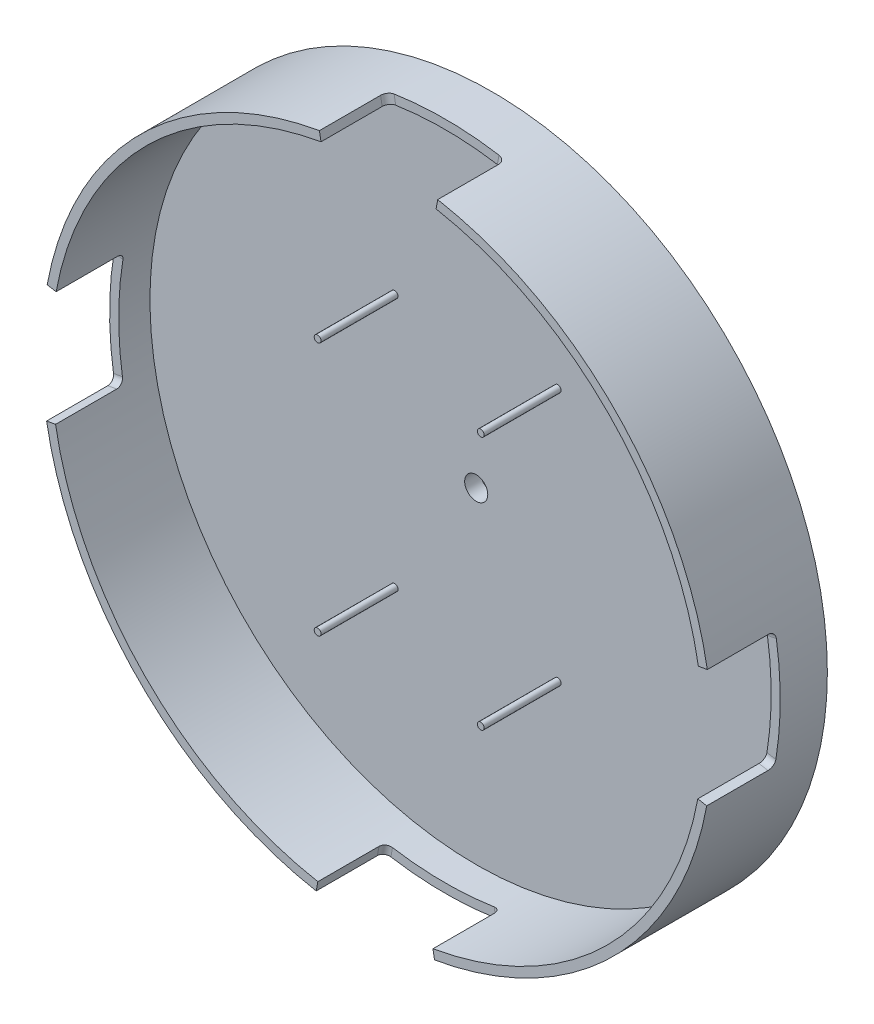
from build123d import *

# Parameters (mm, degrees)
SKETCH1_R           = 74
SKETCH1_R_2         = 2.55
BOSS_EXTRUDE1_DEPTH = 3.5
SKETCH2_R           = 32.5
SKETCH2_R_2         = 16
CUT_EXTRUDE4_DEPTH  = 1
FILLET1_R           = 1.5
FILLET2_R           = 1.5
SKETCH3_R           = 74
SKETCH3_R_2         = 72
BOSS_EXTRUDE2_DEPTH = 25.4
CUT_EXTRUDE5_START  = -15
CUT_EXTRUDE5_DEPTH  = 15
CIRPATTERN2_COUNT   = 4
FILLET4_R           = 1.5
SKETCH6_R           = 0.75
BOSS_EXTRUDE3_DEPTH = 17


with BuildPart() as part:
    # Sketch1 → Boss-Extrude1 (new body)
    with BuildSketch(Plane.XY):
        Circle(SKETCH1_R)
        Circle(SKETCH1_R_2, mode=Mode.SUBTRACT)
    extrude(amount=BOSS_EXTRUDE1_DEPTH)

    # Sketch2 → Cut-Extrude4 (cut)
    with BuildSketch(Plane.XY):
        Circle(SKETCH2_R)
        Circle(SKETCH2_R_2, mode=Mode.SUBTRACT)
    extrude(amount=CUT_EXTRUDE4_DEPTH, mode=Mode.SUBTRACT)

    # Fillet1
    # the kernel refuses this fillet: 1.5 mm, written as the material it takes off along each edge
    with BuildSketch(Plane(origin=(0, 0, 0), x_dir=(1, 0, 0), z_dir=(0, -1, 0))) as fillet1_piece_1:
        with BuildLine():
            CenterArc((33.914213562, 1.5), FILLET1_R, 199.471220634, 70.528779366)
            Line((32.5, 1), (32.471715729, 0.99))
            ThreePointArc((32.471715729, 0.99), (32.47, 0.5), (32.47, 0))
            Line((32.47, 0), (32.5, -0.03))
            Line((32.5, -0.03), (33.914213562, -0.03))
            Line((33.914213562, -0.03), (33.914213562, 0))
        make_face()
    revolve(axis=Axis((0, 0, 0), (0, 0, 1)), mode=Mode.SUBTRACT)

    # Fillet2
    # the kernel refuses this fillet: 1.5 mm, written as the material it takes off along each edge
    with BuildSketch(Plane(origin=(0, 0, 0), x_dir=(1, 0, 0), z_dir=(0, -1, 0))) as fillet2_piece_1:
        with BuildLine():
            CenterArc((14.585786438, 1.5), FILLET2_R, 270, 70.528779366)
            Line((16, 1), (16.028284271, 0.99))
            ThreePointArc((16.028284271, 0.99), (16.03, 0.5), (16.03, 0))
            Line((16.03, 0), (16, -0.03))
            Line((16, -0.03), (14.585786438, -0.03))
            Line((14.585786438, -0.03), (14.585786438, 0))
        make_face()
    revolve(axis=Axis((0, 0, 0), (0, 0, 1)), mode=Mode.SUBTRACT)

    # Sketch3 → Boss-Extrude2 (add)
    with BuildSketch(Plane.XY):
        Circle(SKETCH3_R)
        Circle(SKETCH3_R_2, mode=Mode.SUBTRACT)
    extrude(amount=BOSS_EXTRUDE2_DEPTH)

    # Sketch5 → Cut-Extrude5 (cut)
    with BuildSketch(Plane.XY.offset(25.4).offset(CUT_EXTRUDE5_START)):
        with BuildLine():
            Line((-12.354120349, 70.932190932), (-12.697290359, 72.902529569))
            ThreePointArc((-12.697290359, 72.902529569), (0.361150189, 73.999118715), (13.408265197, 72.775122291))
            Line((13.408265197, 72.775122291), (13.045879651, 70.808227094))
            ThreePointArc((13.045879651, 70.808227094), (0.351389373, 71.999142533), (-12.354120349, 70.932190932))
        make_face()
    cut_extrude5 = extrude(amount=CUT_EXTRUDE5_DEPTH, mode=Mode.SUBTRACT)

    # CirPattern2: Cut-Extrude5 ×4 about axis
    cirpattern2_axis = Axis((0, 0, 0), (0, 0, -1))
    for i in range(1, CIRPATTERN2_COUNT):
        add(cut_extrude5.rotate(cirpattern2_axis, i * 360 / CIRPATTERN2_COUNT), mode=Mode.SUBTRACT)

    # Fillet4
    fillet4_edges = [part.edges().sort_by_distance(p)[0] for p in [
        (13.227072424, 71.791674692, 10.4),
        (-12.525705354, 71.91736025, 10.4),
        (-71.791674692, 13.227072424, 10.4),
        (-71.91736025, -12.525705354, 10.4),
        (-13.227072424, -71.791674692, 10.4),
        (12.525705354, -71.91736025, 10.4),
        (71.791674692, -13.227072424, 10.4),
        (71.91736025, 12.525705354, 10.4),
    ]]
    fillet(fillet4_edges, radius=FILLET4_R)

    # Sketch6 → Boss-Extrude3 (add)
    with BuildSketch(Plane.XY.offset(3.5)):
        with Locations((18, 28)):
            Circle(SKETCH6_R)
        with Locations((-18, 28)):
            Circle(SKETCH6_R)
        with Locations((-18, -28)):
            Circle(SKETCH6_R)
        with Locations((18, -28)):
            Circle(SKETCH6_R)
    extrude(amount=BOSS_EXTRUDE3_DEPTH)


solid = part.part
